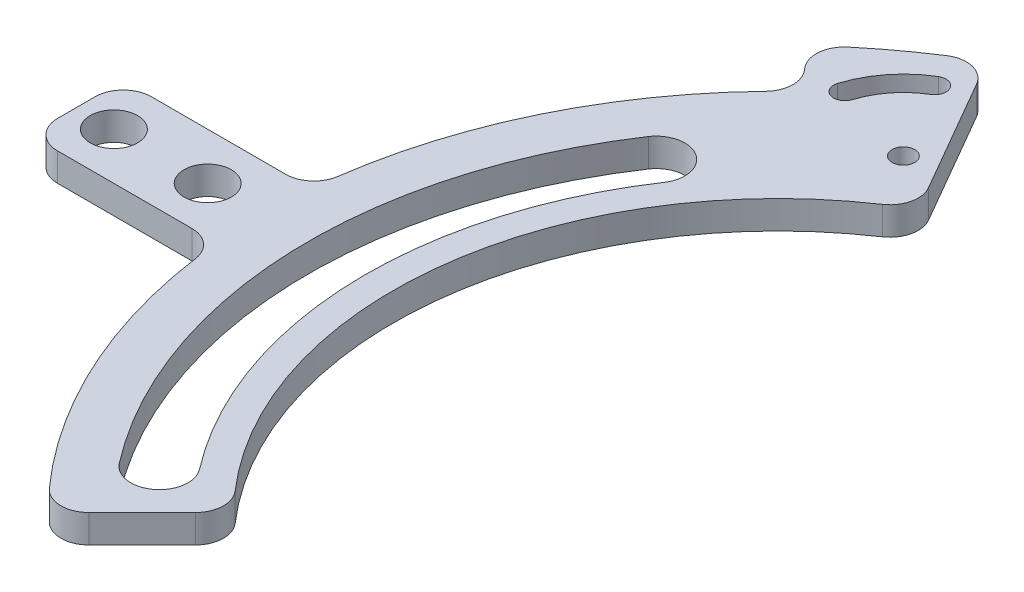
from build123d import *

# Parameters (mm, degrees)
BOSS_EXTRUDE1_DEPTH          = 3
CUT_EXTRUDE_THIN1_DEPTH      = 73.819983521
CUT_EXTRUDE_THIN1_DEPTH_BACK = 3
FILLET1_R                    = 3.05
BOSS_EXTRUDE2_DEPTH          = 3
CUT_EXTRUDE1_DEPTH           = 77.32004979
CUT_EXTRUDE1_DEPTH_BACK      = 77.32004979
SKETCH4_R                    = 1.2
CUT_EXTRUDE_THIN2_DEPTH      = 77.32004979
CUT_EXTRUDE_THIN2_DEPTH_BACK = 3
FILLET2_R                    = 1.2
SKETCH6_W                    = 20
SKETCH6_H                    = 10
SKETCH6_R                    = 2.525
BOSS_EXTRUDE3_DEPTH          = 3
FILLET3_R                    = 3


with BuildPart() as part:
    # Sketch1 → Boss-Extrude1 (new body)
    with BuildSketch(Plane(origin=(0, 0, 0), x_dir=(1, 0, 0), z_dir=(0, 1, 0))):
        with BuildLine():
            Line((-27.5, 47.631397208), (-20.5, 35.507041555))
            ThreePointArc((-20.5, 35.507041555), (-40.649239316, 5.351573881), (-28.991378029, -28.991378029))
            Line((-28.991378029, -28.991378029), (-38.890872965, -38.890872965))
            ThreePointArc((-38.890872965, -38.890872965), (-54.529467376, 7.178940572), (-27.5, 47.631397208))
        make_face()
    extrude(amount=BOSS_EXTRUDE1_DEPTH)

    # Sketch2 → Cut-Extrude-Thin1 (cut, two sides: drawn at the far end of the back side and taken through both)
    with BuildSketch(Plane(origin=(0, 3, 0), x_dir=(1, 0, 0), z_dir=(0, 1, 0)).offset(-CUT_EXTRUDE_THIN1_DEPTH_BACK)):
        with BuildLine():
            ThreePointArc((-32.997630308, -29.03030992), (-43.925085447, -1.479651456), (-34.876429564, 26.743918204))
            Line((-34.876429564, 26.743918204), (-39.717071665, 30.455815838))
            ThreePointArc((-39.717071665, 30.455815838), (-50.021627455, -1.685018325), (-37.577506187, -33.0595452))
            Line((-37.577506187, -33.0595452), (-32.997630308, -29.03030992))
        make_face()
    extrude(amount=CUT_EXTRUDE_THIN1_DEPTH + CUT_EXTRUDE_THIN1_DEPTH_BACK, mode=Mode.SUBTRACT)

    # Fillet1
    fillet1_edges = [part.edges().sort_by_distance(p)[0] for p in [
        (-39.717071665, 1.5, -30.455815838),
        (-34.876429564, 1.5, -26.743918204),
        (-32.997630308, 1.5, 29.03030992),
        (-37.577506187, 1.5, 33.0595452),
    ]]
    fillet(fillet1_edges, radius=FILLET1_R - 0.0001)  # a hair under: the kernel refuses the full size

    # Sketch3 → Boss-Extrude2 (add)
    with BuildSketch(Plane(origin=(0, 0, 0), x_dir=(1, 0, 0), z_dir=(0, 1, 0))):
        with BuildLine():
            Line((-27.5, 47.631397208), (-30.5, 52.827549631))
            ThreePointArc((-30.5, 52.827549631), (-36.284189992, 49.035268498), (-41.601899964, 44.612575799))
            Line((-41.601899964, 44.612575799), (-37.509909803, 40.224453589))
            ThreePointArc((-37.509909803, 40.224453589), (-32.715253271, 44.212127334), (-27.5, 47.631397208))
        make_face()
    extrude(amount=BOSS_EXTRUDE2_DEPTH)

    # Sketch4 → Cut-Extrude1 (cut, two sides: drawn at the far end of the back side and taken through both)
    with BuildSketch(Plane(origin=(0, 3, 0), x_dir=(1, 0, 0), z_dir=(0, 1, 0)).offset(-CUT_EXTRUDE1_DEPTH_BACK)):
        with Locations(Location((-26.217006802, 39.609576548, 0), (0, 0, 270))):
            Circle(SKETCH4_R)
    extrude(amount=CUT_EXTRUDE1_DEPTH + CUT_EXTRUDE1_DEPTH_BACK, mode=Mode.SUBTRACT)

    # Sketch5 → Cut-Extrude-Thin2 (cut, two sides: drawn at the far end of the back side and taken through both)
    with BuildSketch(Plane(origin=(0, 3, 0), x_dir=(1, 0, 0), z_dir=(0, 1, 0)).offset(-CUT_EXTRUDE_THIN2_DEPTH_BACK)):
        with BuildLine():
            ThreePointArc((-30.458263972, 49.433106342), (-34.605510743, 46.252091255), (-36.751172642, 41.486102609))
            Line((-36.751172642, 41.486102609), (-34.388369089, 41.065199567))
            ThreePointArc((-34.388369089, 41.065199567), (-32.723977149, 44.762181415), (-29.506953953, 47.22969779))
            Line((-29.506953953, 47.22969779), (-30.458263972, 49.433106342))
        make_face()
    extrude(amount=CUT_EXTRUDE_THIN2_DEPTH + CUT_EXTRUDE_THIN2_DEPTH_BACK, mode=Mode.SUBTRACT)

    # Fillet2
    fillet2_edges = [part.edges().sort_by_distance(p)[0] for p in [
        (-34.388369089, 1.5, -41.065199567),
        (-36.751172642, 1.5, -41.486102609),
        (-30.458263972, 1.5, -49.433106342),
        (-29.506953953, 1.5, -47.22969779),
    ]]
    fillet(fillet2_edges, radius=FILLET2_R - 0.0001)  # a hair under: the kernel refuses the full size

    # Sketch6 → Boss-Extrude3 (add)
    with BuildSketch(Plane(origin=(0, 0, 0), x_dir=(1, 0, 0), z_dir=(0, 1, 0))):
        with Locations((-64.772255751, 0)):
            Rectangle(SKETCH6_W, SKETCH6_H)
        with Locations(Location((-70.772255751, 0, 0), (0, 0, 90))):
            Circle(SKETCH6_R, mode=Mode.SUBTRACT)
        with Locations(Location((-60.772255751, 0, 0), (0, 0, 90))):
            Circle(SKETCH6_R, mode=Mode.SUBTRACT)
    extrude(amount=BOSS_EXTRUDE3_DEPTH)

    # Fillet3
    fillet3_edges = [part.edges().sort_by_distance(p)[0] for p in [
        (-74.772255751, 1.5, 5),
        (-74.772255751, 1.5, -5),
        (-54.772255751, 1.5, 5),
        (-54.772255751, 1.5, -5),
        (-37.509909803, 1.5, -40.224453589),
        (-41.601899964, 1.5, -44.612575799),
        (-30.5, 1.5, -52.827549631),
        (-20.5, 1.5, -35.507041555),
        (-28.991378029, 1.5, 28.991378029),
        (-38.890872965, 1.5, 38.890872965),
    ]]
    fillet(fillet3_edges, radius=FILLET3_R - 0.0001)  # a hair under: the kernel refuses the full size


solid = part.part
